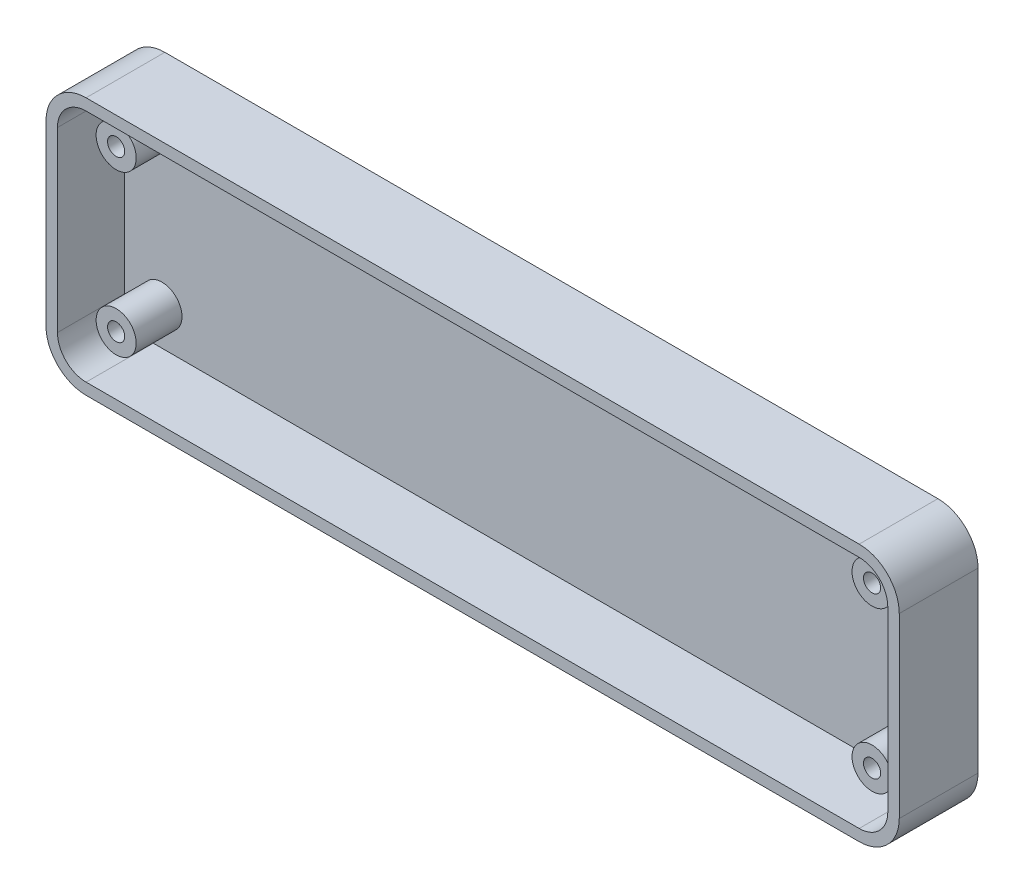
from build123d import *

# Parameters (mm, degrees)
SALIENTE_EXTRUIR1_DEPTH   = 13.75
CROQUIS1_R                = 3.5
CROQUIS1_R_2              = 1.5
SALIENTE_EXTRUIR1_2_DEPTH = 13.75
SALIENTE_EXTRUIR1_3_DEPTH = 13.75
SALIENTE_EXTRUIR1_4_DEPTH = 13.75
SALIENTE_EXTRUIR1_5_DEPTH = 13.75
SALIENTE_EXTRUIR2_START   = -2
SALIENTE_EXTRUIR2_DEPTH   = 2
CROQUIS5_R                = 3.5
CROQUIS5_R_2              = 1.5
CORTAR_EXTRUIR1_DEPTH     = 3.75


with BuildPart() as part:
    # Croquis1 → Saliente-Extruir1 (new body)
    with BuildSketch(Plane.XY):
        with BuildLine():
            Line((67.5, 22.5), (-67.5, 22.5))
            ThreePointArc((-67.5, 22.5), (-72.449747468, 20.449747468), (-74.5, 15.5))
            Line((-74.5, 15.5), (-74.5, -15.5))
            ThreePointArc((-74.5, -15.5), (-72.449747468, -20.449747468), (-67.5, -22.5))
            Line((-67.5, -22.5), (67.5, -22.5))
            ThreePointArc((67.5, -22.5), (72.449747468, -20.449747468), (74.5, -15.5))
            Line((74.5, -15.5), (74.5, 15.5))
            ThreePointArc((74.5, 15.5), (72.449747468, 20.449747468), (67.5, 22.5))
        make_face()
        with BuildLine():
            ThreePointArc((-72.5, 15.5), (-71.035533906, 19.035533906), (-67.5, 20.5))
            Line((-67.5, 20.5), (67.5, 20.5))
            ThreePointArc((67.5, 20.5), (71.035533906, 19.035533906), (72.5, 15.5))
            Line((72.5, 15.5), (72.5, -15.5))
            ThreePointArc((72.5, -15.5), (71.035533906, -19.035533906), (67.5, -20.5))
            Line((67.5, -20.5), (-67.5, -20.5))
            ThreePointArc((-67.5, -20.5), (-71.035533906, -19.035533906), (-72.5, -15.5))
            Line((-72.5, -15.5), (-72.5, 15.5))
        make_face(mode=Mode.SUBTRACT)
    extrude(amount=-SALIENTE_EXTRUIR1_DEPTH)



with BuildPart() as body_2:
    # Croquis1 → Saliente-Extruir1 2 (new body)
    with BuildSketch(Plane.XY):
        with Locations((-66, 14)):
            Circle(CROQUIS1_R)
        with Locations((-66, 14)):
            Circle(CROQUIS1_R_2, mode=Mode.SUBTRACT)
    extrude(amount=-SALIENTE_EXTRUIR1_2_DEPTH)


with BuildPart() as body_3:
    # Croquis1 → Saliente-Extruir1 3 (new body)
    with BuildSketch(Plane.XY):
        with Locations((66, 14)):
            Circle(CROQUIS1_R)
        with Locations((66, 14)):
            Circle(CROQUIS1_R_2, mode=Mode.SUBTRACT)
    extrude(amount=-SALIENTE_EXTRUIR1_3_DEPTH)


with BuildPart() as body_4:
    # Croquis1 → Saliente-Extruir1 4 (new body)
    with BuildSketch(Plane.XY):
        with Locations((66, -14)):
            Circle(CROQUIS1_R)
        with Locations((66, -14)):
            Circle(CROQUIS1_R_2, mode=Mode.SUBTRACT)
    extrude(amount=-SALIENTE_EXTRUIR1_4_DEPTH)


with BuildPart() as body_5:
    # Croquis1 → Saliente-Extruir1 5 (new body)
    with BuildSketch(Plane.XY):
        with Locations((-66, -14)):
            Circle(CROQUIS1_R)
        with Locations((-66, -14)):
            Circle(CROQUIS1_R_2, mode=Mode.SUBTRACT)
    extrude(amount=-SALIENTE_EXTRUIR1_5_DEPTH)


with BuildPart() as part_1:
    add(part.part)

    add(body_2.part)  # Saliente-Extruir2 merges body 2

    add(body_3.part)  # Saliente-Extruir2 merges body 3

    add(body_4.part)  # Saliente-Extruir2 merges body 4

    add(body_5.part)  # Saliente-Extruir2 merges body 5
    # Croquis3 → Saliente-Extruir2 (add)
    with BuildSketch(Plane(origin=(0, 0, -13.75), x_dir=(-1, 0, 0), z_dir=(0, 0, -1)).offset(SALIENTE_EXTRUIR2_START)):
        with BuildLine():
            Line((72.5, 15.5), (72.5, -15.5))
            ThreePointArc((72.5, -15.5), (71.035533906, -19.035533906), (67.5, -20.5))
            Line((67.5, -20.5), (-67.5, -20.5))
            ThreePointArc((-67.5, -20.5), (-71.035533906, -19.035533906), (-72.5, -15.5))
            Line((-72.5, -15.5), (-72.5, 15.5))
            ThreePointArc((-72.5, 15.5), (-71.035533906, 19.035533906), (-67.5, 20.5))
            Line((-67.5, 20.5), (67.5, 20.5))
            ThreePointArc((67.5, 20.5), (71.035533906, 19.035533906), (72.5, 15.5))
        make_face()
    extrude(amount=SALIENTE_EXTRUIR2_DEPTH)

    # Croquis5 → Cortar-Extruir1 (cut)
    # profile 1 of 4: a face of its own
    with BuildSketch(Plane.XY):
        with Locations((66, -14)):
            Circle(CROQUIS5_R)
        with Locations((66, -14)):
            Circle(CROQUIS5_R_2, mode=Mode.SUBTRACT)
    # profile 2 of 4: a face of its own
    with BuildSketch(Plane.XY):
        with Locations((66, 14)):
            Circle(CROQUIS5_R)
        with Locations((66, 14)):
            Circle(CROQUIS5_R_2, mode=Mode.SUBTRACT)
    # profile 3 of 4: a face of its own
    with BuildSketch(Plane.XY):
        with Locations((-66, -14)):
            Circle(CROQUIS5_R)
        with Locations((-66, -14)):
            Circle(CROQUIS5_R_2, mode=Mode.SUBTRACT)
    # profile 4 of 4: a face of its own
    with BuildSketch(Plane.XY):
        with Locations((-66, 14)):
            Circle(CROQUIS5_R)
        with Locations((-66, 14)):
            Circle(CROQUIS5_R_2, mode=Mode.SUBTRACT)
    extrude(amount=-CORTAR_EXTRUIR1_DEPTH, mode=Mode.SUBTRACT)


solid = part_1.part
